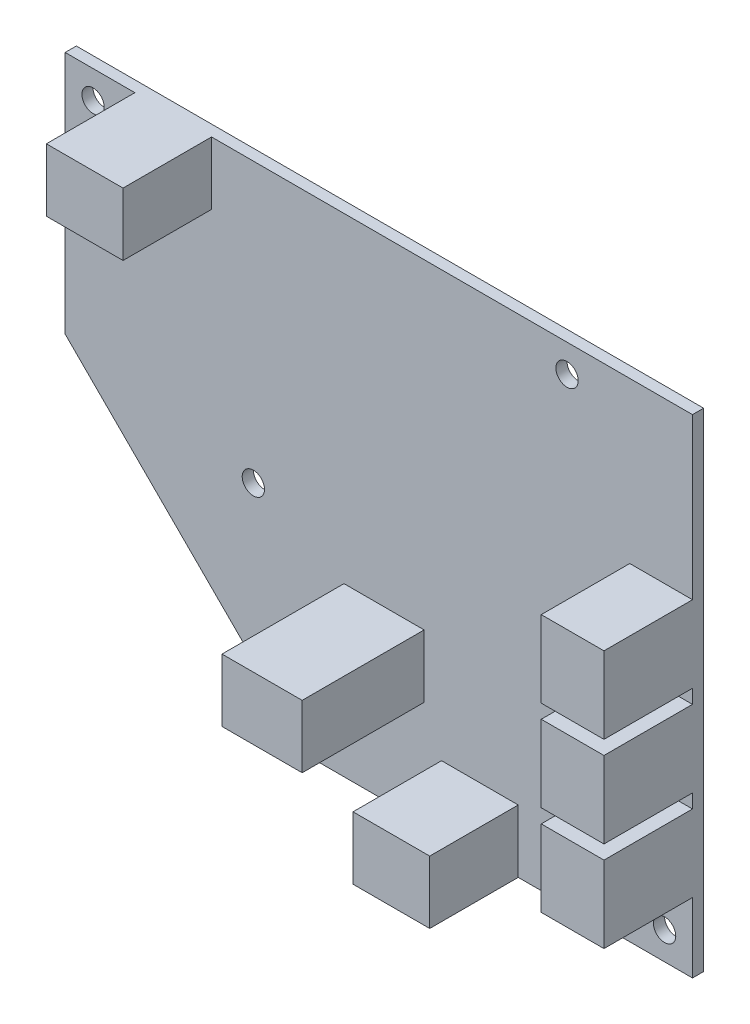
from build123d import *

# Parameters (mm, degrees)
ESQUISSE1_R        = 1.6
BOSS_EXTRU_1_DEPTH = 1.6
ESQUISSE2_W        = 11
ESQUISSE2_H        = 9
ESQUISSE2_W_2      = 9
ESQUISSE2_H_2      = 11
BOSS_EXTRU_2_DEPTH = 12.7
ESQUISSE3_W        = 11.5
ESQUISSE3_H        = 9
BOSS_EXTRU_3_DEPTH = 17.5


with BuildPart() as part:
    # Esquisse1 → Boss.-Extru.1 (new body)
    with BuildSketch(Plane.XY):
        Polygon((0, 0), (90, 0), (90, -70), (35, -70), (0, -35), align=None)
        with Locations((4, -4)):
            Circle(ESQUISSE1_R, mode=Mode.SUBTRACT)
        with Locations((72, -4)):
            Circle(ESQUISSE1_R, mode=Mode.SUBTRACT)
        with Locations((27, -40)):
            Circle(ESQUISSE1_R, mode=Mode.SUBTRACT)
        with Locations((86, -66)):
            Circle(ESQUISSE1_R, mode=Mode.SUBTRACT)
    extrude(amount=BOSS_EXTRU_1_DEPTH)

    # Esquisse2 → Boss.-Extru.2 (add)
    with BuildSketch(Plane.XY.offset(1.6)):
        with Locations((15.5, -4.5)):
            Rectangle(ESQUISSE2_W, ESQUISSE2_H)
        with Locations((59.5, -65.5)):
            Rectangle(ESQUISSE2_W, ESQUISSE2_H)
        with Locations((85.5, -54.5)):
            Rectangle(ESQUISSE2_W_2, ESQUISSE2_H_2)
        with Locations((85.5, -41.5)):
            Rectangle(ESQUISSE2_W_2, ESQUISSE2_H_2)
        with Locations((85.5, -28.5)):
            Rectangle(ESQUISSE2_W_2, ESQUISSE2_H_2)
    extrude(amount=BOSS_EXTRU_2_DEPTH)

    # Esquisse3 → Boss.-Extru.3 (add)
    with BuildSketch(Plane.XY.offset(1.6)):
        with Locations((45.75, -50.5)):
            Rectangle(ESQUISSE3_W, ESQUISSE3_H)
    extrude(amount=BOSS_EXTRU_3_DEPTH)


solid = part.part
